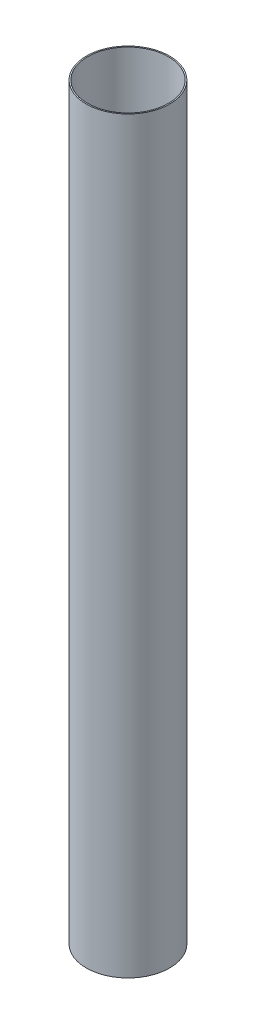
from build123d import *

# Parameters (mm, degrees)
BOSS_EXTRUDE1_DEPTH      = 725
BOSS_EXTRUDE1_DEPTH_BACK = 725
SKETCH1_R                = 80.75
SKETCH1_R_2              = 78.35


with BuildPart() as part:
    # Sketch1 → Boss-Extrude1 (new, two sides: drawn at the far end of the back side and taken through both)
    with BuildSketch(Plane(origin=(0, 0, 0), x_dir=(1, 0, 0), z_dir=(0, 1, 0)).offset(-BOSS_EXTRUDE1_DEPTH_BACK)):
        Circle(SKETCH1_R)
        Circle(SKETCH1_R_2, mode=Mode.SUBTRACT)
    extrude(amount=BOSS_EXTRUDE1_DEPTH + BOSS_EXTRUDE1_DEPTH_BACK)


solid = part.part
